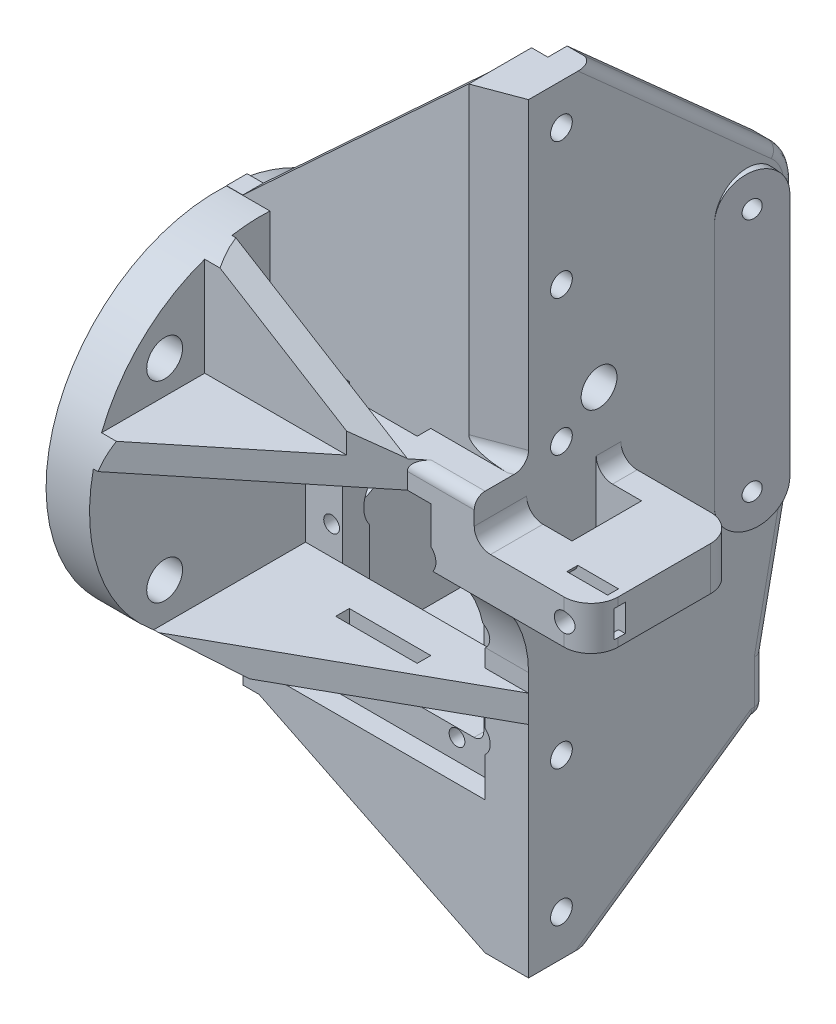
from build123d import *

# Parameters (mm, degrees)
SKETCH1_R                           = 1.45
BOSS_EXTRUDE1_DEPTH                 = 3
BOSS_EXTRUDE2_START                 = -30
SKETCH1_3_R                         = 1.45
BOSS_EXTRUDE2_DEPTH                 = 3
SKETCH2_W                           = 24.17
SKETCH2_H                           = 13.191875796
CUT_EXTRUDE1_DEPTH                  = 67.8688194
SKETCH3_W                           = 5
SKETCH3_H                           = 56.2
BOSS_EXTRUDE3_DEPTH                 = 33
SKETCH4_W                           = 49.6
SKETCH4_H                           = 5
BOSS_EXTRUDE4_DEPTH                 = 36
SKETCH6_R                           = 31.5
BOSS_EXTRUDE6_DEPTH                 = 5
F_6_0MM_CLEARANCE_DOWEL_HOLE1_D     = 3
F_6_0MM_CLEARANCE_DOWEL_HOLE1_DEPTH = 20
F_6_0MM_CLEARANCE_DOWEL_HOLE1_TIP   = 0.901290929
BOSS_EXTRUDE7_DEPTH                 = 5
SKETCH11_W                          = 12.1
SKETCH11_H                          = 140
BOSS_EXTRUDE8_DEPTH                 = 8
SKETCH12_R                          = 1.45
BOSS_EXTRUDE9_DEPTH                 = 2
BOSS_EXTRUDE12_DEPTH                = 5
BOSS_EXTRUDE13_DEPTH                = 5
BOSS_EXTRUDE14_DEPTH                = 5
CUT_EXTRUDE3_DEPTH                  = 41.6
CUT_EXTRUDE4_DEPTH                  = 20
BOSS_EXTRUDE15_START                = -12.1
BOSS_EXTRUDE15_DEPTH                = 12.1
BOSS_EXTRUDE18_DEPTH                = 3
BOSS_EXTRUDE18_DEPTH_BACK           = 0.8
CUT_EXTRUDE6_DEPTH                  = 150.055833525
CUT_EXTRUDE6_DEPTH_BACK             = 70
SKETCH22_W                          = 7
SKETCH22_H                          = 7.75
BOSS_EXTRUDE19_DEPTH                = 58.4
BOSS_EXTRUDE20_DEPTH                = 5
SKETCH25_W                          = 15
SKETCH25_H                          = 2.5
CUT_EXTRUDE7_DEPTH                  = 10
CUT_EXTRUDE8_START                  = -36.2
SKETCH25_3_W                        = 15
SKETCH25_3_H                        = 2.5
CUT_EXTRUDE8_DEPTH                  = 10
BOSS_EXTRUDE22_DEPTH                = 4
SKETCH29_W                          = 2
SKETCH29_H                          = 5
CUT_EXTRUDE9_DEPTH                  = 40
SKETCH30_R                          = 1.75
CUT_EXTRUDE10_DEPTH                 = 40
SKETCH31_R                          = 2
CUT_EXTRUDE11_DEPTH                 = 7
CUT_EXTRUDE12_START                 = -8
CUT_EXTRUDE12_DEPTH                 = 8
FILLET1_R                           = 2
SKETCH33_W                          = 8
SKETCH33_H                          = 2.6
SKETCH33_H_2                        = 5
SKETCH33_W_2                        = 4.320441989
BOSS_EXTRUDE24_DEPTH                = 10
FILLET3_R                           = 20
FILLET5_R                           = 2
FILLET6_R                           = 2.5
SKETCH34_R                          = 3.3
CUT_EXTRUDE13_DEPTH                 = 138.618212821
FILLET7_R                           = 5
FILLET12_R                          = 3
SKETCH35_W                          = 3
SKETCH35_H                          = 3.55
CUT_EXTRUDE14_DEPTH                 = 114.6
BOSS_EXTRUDE26_START                = 3
SKETCH36_R                          = 3.3
BOSS_EXTRUDE26_DEPTH                = 3
CUT_EXTRUDE15_REACH                 = 137.103
SKETCH37_R                          = 5.5
CUT_EXTRUDE15_DIRECTION_2_DEPTH     = 4.5
FILLET14_R                          = 5
CUT_EXTRUDE16_DEPTH                 = 7
LPATTERN1_COUNT                     = 3
LPATTERN1_PITCH                     = 25
LPATTERN2_COUNT                     = 3
LPATTERN2_PITCH                     = 25
REVOLVE1_ANGLE                      = 10
BOSS_EXTRUDE28_DEPTH                = 5
SKETCH40_R                          = 1.6
CUT_EXTRUDE17_DEPTH                 = 127.74510061
CUT_EXTRUDE20_START                 = -4
SKETCH44_R                          = 3.25
CUT_EXTRUDE20_DEPTH                 = 35
CUT_EXTRUDE21_REACH                 = 143.668
SKETCH48_W                          = 39.6
SKETCH48_H                          = 56.2
CUT_EXTRUDE23_DEPTH                 = 1.2
CUT_EXTRUDE24_DEPTH                 = 99.09345212
CUT_EXTRUDE24_DEPTH_BACK            = 99.09345212
SKETCH50_W                          = 39.6
SKETCH50_H                          = 31.2
CUT_EXTRUDE25_DEPTH                 = 1.5
BOSS_EXTRUDE29_START                = 2
SKETCH51_R                          = 1.45
BOSS_EXTRUDE29_DEPTH                = 2
BOSS_EXTRUDE30_START                = -5
BOSS_EXTRUDE30_DEPTH                = 5
FILLET15_R                          = 2
FILLET16_R                          = 2
SKETCH53_R                          = 2.75
CUT_EXTRUDE26_DEPTH                 = 127.854538645


with BuildPart() as part:
    # Sketch1 → Boss-Extrude1 (new body)
    # profile 1 of 2: a face of its own
    with BuildSketch(Plane.XY):
        with BuildLine():
            Line((-11.785, 45), (-11.279987437, 45))
            ThreePointArc((-11.279987437, 45), (-10.804615242, 45.223368794), (-10.285, 45.3))
            Line((-10.285, 45.3), (10.285, 45.3))
            ThreePointArc((10.285, 45.3), (10.804615242, 45.223368794), (11.279987437, 45))
            Line((11.279987437, 45), (11.786572875, 45))
            ThreePointArc((11.786572875, 45), (12.169256308, 44.923879533), (12.493679656, 44.707106781))
            Line((12.493679656, 44.707106781), (17.507893219, 39.692893219))
            ThreePointArc((17.507893219, 39.692893219), (17.72466597, 39.36846987), (17.800786438, 38.985786438))
            Line((17.800786438, 38.985786438), (17.800786438, 0.414213562))
            ThreePointArc((17.800786438, 0.414213562), (17.72466597, 0.03153013), (17.507893219, -0.292893219))
            Line((17.507893219, -0.292893219), (12.493679656, -5.307106781))
            ThreePointArc((12.493679656, -5.307106781), (12.169256308, -5.523879533), (11.786572875, -5.6))
            Line((11.786572875, -5.6), (24.800786438, -5.6))
            Line((24.800786438, -5.6), (24.800786438, 50.6))
            Line((24.800786438, 50.6), (-24.799213562, 50.6))
            Line((-24.799213562, 50.6), (-24.799213562, -5.6))
            Line((-24.799213562, -5.6), (-11.785, -5.6))
            ThreePointArc((-11.785, -5.6), (-12.167683432, -5.523879533), (-12.492106781, -5.307106781))
            Line((-12.492106781, -5.307106781), (-17.506320344, -0.292893219))
            ThreePointArc((-17.506320344, -0.292893219), (-17.723093095, 0.03153013), (-17.799213562, 0.414213562))
            Line((-17.799213562, 0.414213562), (-17.799213562, 38.985786438))
            ThreePointArc((-17.799213562, 38.985786438), (-17.723093095, 39.36846987), (-17.506320344, 39.692893219))
            Line((-17.506320344, 39.692893219), (-12.492106781, 44.707106781))
            ThreePointArc((-12.492106781, 44.707106781), (-12.167683432, 44.923879533), (-11.785, 45))
        make_face()
    # profile 2 of 2: a face of its own
    with BuildSketch(Plane.XY):
        with BuildLine():
            ThreePointArc((-12.085, 43.5), (-11.871029222, 44.351182299), (-11.279987437, 45))
            Line((-11.279987437, 45), (-11.785, 45))
            ThreePointArc((-11.785, 45), (-12.167683432, 44.923879533), (-12.492106781, 44.707106781))
            Line((-12.492106781, 44.707106781), (-17.506320344, 39.692893219))
            ThreePointArc((-17.506320344, 39.692893219), (-17.723093095, 39.36846987), (-17.799213562, 38.985786438))
            Line((-17.799213562, 38.985786438), (-17.799213562, 0.414213562))
            ThreePointArc((-17.799213562, 0.414213562), (-17.723093095, 0.03153013), (-17.506320344, -0.292893219))
            Line((-17.506320344, -0.292893219), (-12.492106781, -5.307106781))
            ThreePointArc((-12.492106781, -5.307106781), (-12.167683432, -5.523879533), (-11.785, -5.6))
            Line((-11.785, -5.6), (11.786572875, -5.6))
            ThreePointArc((11.786572875, -5.6), (12.169256308, -5.523879533), (12.493679656, -5.307106781))
            Line((12.493679656, -5.307106781), (17.507893219, -0.292893219))
            ThreePointArc((17.507893219, -0.292893219), (17.72466597, 0.03153013), (17.800786438, 0.414213562))
            Line((17.800786438, 0.414213562), (17.800786438, 38.985786438))
            ThreePointArc((17.800786438, 38.985786438), (17.72466597, 39.36846987), (17.507893219, 39.692893219))
            Line((17.507893219, 39.692893219), (12.493679656, 44.707106781))
            ThreePointArc((12.493679656, 44.707106781), (12.169256308, 44.923879533), (11.786572875, 45))
            Line((11.786572875, 45), (11.279987437, 45))
            ThreePointArc((11.279987437, 45), (11.871029222, 44.351182299), (12.085, 43.5))
            Line((12.085, 43.5), (12.085, 1.5))
            ThreePointArc((12.085, 1.5), (11.557792206, 0.227207794), (10.285, -0.3))
            Line((10.285, -0.3), (-10.285, -0.3))
            ThreePointArc((-10.285, -0.3), (-11.557792206, 0.227207794), (-12.085, 1.5))
            Line((-12.085, 1.5), (-12.085, 43.5))
        make_face()
        with Locations((-14.999213562, 2.7)):
            Circle(SKETCH1_R, mode=Mode.SUBTRACT)
        with Locations((-7.697477522, -2.8)):
            Circle(SKETCH1_R, mode=Mode.SUBTRACT)
        with Locations((-14.999213562, 19.7)):
            Circle(SKETCH1_R, mode=Mode.SUBTRACT)
        with Locations((8.076300654, -2.8)):
            Circle(SKETCH1_R, mode=Mode.SUBTRACT)
        with Locations((15.000786438, 2.7)):
            Circle(SKETCH1_R, mode=Mode.SUBTRACT)
        with Locations((15.000786438, 19.7)):
            Circle(SKETCH1_R, mode=Mode.SUBTRACT)
        with Locations((-14.999213562, 36.7)):
            Circle(SKETCH1_R, mode=Mode.SUBTRACT)
        with Locations((15.000786438, 36.7)):
            Circle(SKETCH1_R, mode=Mode.SUBTRACT)
    extrude(amount=BOSS_EXTRUDE1_DEPTH)


with BuildPart() as body_2:
    # Sketch1<3> → Boss-Extrude2 (new body)
    # profile 1 of 2: a face of its own
    with BuildSketch(Plane.XY.offset(BOSS_EXTRUDE2_START)):
        with BuildLine():
            Line((-11.785, 45), (-11.279987437, 45))
            ThreePointArc((-11.279987437, 45), (-10.804615242, 45.223368794), (-10.285, 45.3))
            Line((-10.285, 45.3), (10.285, 45.3))
            ThreePointArc((10.285, 45.3), (10.804615242, 45.223368794), (11.279987437, 45))
            Line((11.279987437, 45), (11.786572875, 45))
            ThreePointArc((11.786572875, 45), (12.169256308, 44.923879533), (12.493679656, 44.707106781))
            Line((12.493679656, 44.707106781), (17.507893219, 39.692893219))
            ThreePointArc((17.507893219, 39.692893219), (17.72466597, 39.36846987), (17.800786438, 38.985786438))
            Line((17.800786438, 38.985786438), (17.800786438, 0.414213562))
            ThreePointArc((17.800786438, 0.414213562), (17.72466597, 0.03153013), (17.507893219, -0.292893219))
            Line((17.507893219, -0.292893219), (12.493679656, -5.307106781))
            ThreePointArc((12.493679656, -5.307106781), (12.169256308, -5.523879533), (11.786572875, -5.6))
            Line((11.786572875, -5.6), (24.800786438, -5.6))
            Line((24.800786438, -5.6), (24.800786438, 50.6))
            Line((24.800786438, 50.6), (-24.799213562, 50.6))
            Line((-24.799213562, 50.6), (-24.799213562, -5.6))
            Line((-24.799213562, -5.6), (-11.785, -5.6))
            ThreePointArc((-11.785, -5.6), (-12.167683432, -5.523879533), (-12.492106781, -5.307106781))
            Line((-12.492106781, -5.307106781), (-17.506320344, -0.292893219))
            ThreePointArc((-17.506320344, -0.292893219), (-17.723093095, 0.03153013), (-17.799213562, 0.414213562))
            Line((-17.799213562, 0.414213562), (-17.799213562, 38.985786438))
            ThreePointArc((-17.799213562, 38.985786438), (-17.723093095, 39.36846987), (-17.506320344, 39.692893219))
            Line((-17.506320344, 39.692893219), (-12.492106781, 44.707106781))
            ThreePointArc((-12.492106781, 44.707106781), (-12.167683432, 44.923879533), (-11.785, 45))
        make_face()
    # profile 2 of 2: a face of its own
    with BuildSketch(Plane.XY.offset(BOSS_EXTRUDE2_START)):
        with BuildLine():
            ThreePointArc((-12.085, 43.5), (-11.871029222, 44.351182299), (-11.279987437, 45))
            Line((-11.279987437, 45), (-11.785, 45))
            ThreePointArc((-11.785, 45), (-12.167683432, 44.923879533), (-12.492106781, 44.707106781))
            Line((-12.492106781, 44.707106781), (-17.506320344, 39.692893219))
            ThreePointArc((-17.506320344, 39.692893219), (-17.723093095, 39.36846987), (-17.799213562, 38.985786438))
            Line((-17.799213562, 38.985786438), (-17.799213562, 0.414213562))
            ThreePointArc((-17.799213562, 0.414213562), (-17.723093095, 0.03153013), (-17.506320344, -0.292893219))
            Line((-17.506320344, -0.292893219), (-12.492106781, -5.307106781))
            ThreePointArc((-12.492106781, -5.307106781), (-12.167683432, -5.523879533), (-11.785, -5.6))
            Line((-11.785, -5.6), (11.786572875, -5.6))
            ThreePointArc((11.786572875, -5.6), (12.169256308, -5.523879533), (12.493679656, -5.307106781))
            Line((12.493679656, -5.307106781), (17.507893219, -0.292893219))
            ThreePointArc((17.507893219, -0.292893219), (17.72466597, 0.03153013), (17.800786438, 0.414213562))
            Line((17.800786438, 0.414213562), (17.800786438, 38.985786438))
            ThreePointArc((17.800786438, 38.985786438), (17.72466597, 39.36846987), (17.507893219, 39.692893219))
            Line((17.507893219, 39.692893219), (12.493679656, 44.707106781))
            ThreePointArc((12.493679656, 44.707106781), (12.169256308, 44.923879533), (11.786572875, 45))
            Line((11.786572875, 45), (11.279987437, 45))
            ThreePointArc((11.279987437, 45), (11.871029222, 44.351182299), (12.085, 43.5))
            Line((12.085, 43.5), (12.085, 1.5))
            ThreePointArc((12.085, 1.5), (11.557792206, 0.227207794), (10.285, -0.3))
            Line((10.285, -0.3), (-10.285, -0.3))
            ThreePointArc((-10.285, -0.3), (-11.557792206, 0.227207794), (-12.085, 1.5))
            Line((-12.085, 1.5), (-12.085, 43.5))
        make_face()
        with Locations((-14.999213562, 2.7)):
            Circle(SKETCH1_3_R, mode=Mode.SUBTRACT)
        with Locations((-7.697477522, -2.8)):
            Circle(SKETCH1_3_R, mode=Mode.SUBTRACT)
        with Locations((-14.999213562, 19.7)):
            Circle(SKETCH1_3_R, mode=Mode.SUBTRACT)
        with Locations((8.076300654, -2.8)):
            Circle(SKETCH1_3_R, mode=Mode.SUBTRACT)
        with Locations((15.000786438, 2.7)):
            Circle(SKETCH1_3_R, mode=Mode.SUBTRACT)
        with Locations((15.000786438, 19.7)):
            Circle(SKETCH1_3_R, mode=Mode.SUBTRACT)
        with Locations((-14.999213562, 36.7)):
            Circle(SKETCH1_3_R, mode=Mode.SUBTRACT)
        with Locations((15.000786438, 36.7)):
            Circle(SKETCH1_3_R, mode=Mode.SUBTRACT)
    extrude(amount=-BOSS_EXTRUDE2_DEPTH)


with BuildPart() as cut_extrude1_tool:
    # Sketch2 → Cut-Extrude1 (new, through all)
    with BuildSketch(Plane.XY.offset(3)):
        with Locations((0, 50.095937898)):
            Rectangle(SKETCH2_W, SKETCH2_H)
    extrude(amount=-CUT_EXTRUDE1_DEPTH)


with BuildPart() as part_1:
    add(part.part)

    # Cut-Extrude1: cut by cut_extrude1_tool
    add(cut_extrude1_tool.part, mode=Mode.SUBTRACT)



with BuildPart() as body_2_1:
    add(body_2.part)

    # Cut-Extrude1: cut by cut_extrude1_tool
    add(cut_extrude1_tool.part, mode=Mode.SUBTRACT)


with BuildPart() as part_2:
    add(part_1.part)

    add(body_2_1.part)  # Boss-Extrude3 merges body 2
    # Sketch3 → Boss-Extrude3 (add)
    with BuildSketch(Plane(origin=(0, 0, -33), x_dir=(-1, 0, 0), z_dir=(0, 0, -1))):
        with Locations((-22.300786438, 22.5)):
            Rectangle(SKETCH3_W, SKETCH3_H)
        with Locations((22.299213562, 22.5)):
            Rectangle(SKETCH3_W, SKETCH3_H)
    extrude(amount=-BOSS_EXTRUDE3_DEPTH)

    # Sketch4 → Boss-Extrude4 (add)
    with BuildSketch(Plane(origin=(0, 0, -33), x_dir=(-1, 0, 0), z_dir=(0, 0, -1))):
        with Locations((-0.000786438, -8.1)):
            Rectangle(SKETCH4_W, SKETCH4_H)
    extrude(amount=-BOSS_EXTRUDE4_DEPTH)

    # Sketch6 → Boss-Extrude6 (add)
    with BuildSketch(Plane.ZY.offset(24.799213562)):
        with Locations((13.25, 39)):
            Circle(SKETCH6_R)
    extrude(amount=-BOSS_EXTRUDE6_DEPTH)

    # Ø6.0mm Clearance Dowel Hole1
    with Locations(Plane.ZY.offset(24.799213562)):
        with Locations((30.92766953, 21.32233047), (-4.42766953, 21.32233047), (-4.42766953, 56.67766953), (30.92766953, 56.67766953)):
            Hole(F_6_0MM_CLEARANCE_DOWEL_HOLE1_D / 2, depth=F_6_0MM_CLEARANCE_DOWEL_HOLE1_DEPTH)
            with Locations((0, 0, -(F_6_0MM_CLEARANCE_DOWEL_HOLE1_DEPTH + F_6_0MM_CLEARANCE_DOWEL_HOLE1_TIP / 2))):  # 118° drill point
                Cone(0, F_6_0MM_CLEARANCE_DOWEL_HOLE1_D / 2, F_6_0MM_CLEARANCE_DOWEL_HOLE1_TIP, mode=Mode.SUBTRACT)

    # Sketch9 → Boss-Extrude7 (add)
    with BuildSketch(Plane.ZY.offset(24.799213562)):
        with BuildLine():
            Line((3, 9.214307126), (3, -10.6))
            Line((3, -10.6), (33.441364403, 14.82234909))
            ThreePointArc((33.441364403, 14.82234909), (18.957032085, 8.021301112), (3, 9.214307126))
        make_face()
        with BuildLine():
            ThreePointArc((-16.036344941, 50.6), (-10.096273097, 60.147140055), (-1.181422858, 66.999714896))
            Line((-1.181422858, 66.999714896), (-33, 50.6))
            Line((-33, 50.6), (-16.036344941, 50.6))
        make_face()
    extrude(amount=-BOSS_EXTRUDE7_DEPTH)

    # Sketch11 → Boss-Extrude8 (add)
    with BuildSketch(Plane(origin=(24.800786438, 0, 0), x_dir=(0, 0, -1), z_dir=(1, 0, 0))):
        with Locations((-2.5, 39)):
            Rectangle(SKETCH11_W, SKETCH11_H)
    extrude(amount=-BOSS_EXTRUDE8_DEPTH)

    # Sketch12 → Boss-Extrude9 (add)
    with BuildSketch(Plane.XY.offset(3)):
        with BuildLine():
            Line((-19.799213562, -10.6), (16.800786438, -10.6))
            Line((16.800786438, -10.6), (16.800786438, 50.6))
            Line((16.800786438, 50.6), (12.085, 50.6))
            Line((12.085, 50.6), (12.085, 1.5))
            ThreePointArc((12.085, 1.5), (11.557792206, 0.227207794), (10.285, -0.3))
            Line((10.285, -0.3), (-10.285, -0.3))
            ThreePointArc((-10.285, -0.3), (-11.557792206, 0.227207794), (-12.085, 1.5))
            Line((-12.085, 1.5), (-12.085, 50.6))
            Line((-12.085, 50.6), (-19.799213562, 50.6))
            Line((-19.799213562, 50.6), (-19.799213562, -10.6))
        make_face()
        with Locations((-14.999213562, 36.7)):
            Circle(SKETCH12_R, mode=Mode.SUBTRACT)
        with Locations((15.000786438, 36.7)):
            Circle(SKETCH12_R, mode=Mode.SUBTRACT)
        with Locations((15.000786438, 19.7)):
            Circle(SKETCH12_R, mode=Mode.SUBTRACT)
        with Locations((15.000786438, 2.7)):
            Circle(SKETCH12_R, mode=Mode.SUBTRACT)
        with Locations((8.076300654, -2.8)):
            Circle(SKETCH12_R, mode=Mode.SUBTRACT)
        with Locations((-7.697477522, -2.8)):
            Circle(SKETCH12_R, mode=Mode.SUBTRACT)
        with Locations((-14.999213562, 2.7)):
            Circle(SKETCH12_R, mode=Mode.SUBTRACT)
        with Locations((-14.999213562, 19.7)):
            Circle(SKETCH12_R, mode=Mode.SUBTRACT)
    extrude(amount=BOSS_EXTRUDE9_DEPTH)

    # Sketch15 → Boss-Extrude12 (add)
    with BuildSketch(Plane(origin=(0, 50.6, 0), x_dir=(1, 0, 0), z_dir=(0, 1, 0))):
        Polygon((-19.799213562, -5), (-19.799213562, -44.75), (24.800786438, -8.55), (24.800786438, -5), (16.800786438, -5), (12.085, -5), align=None)
    extrude(amount=-BOSS_EXTRUDE12_DEPTH)

    # Sketch16 → Boss-Extrude13 (add)
    with BuildSketch(Plane(origin=(0, 14.4, 0), x_dir=(-1, 0, 0), z_dir=(0, -1, 0))):
        Polygon((19.799213562, -33.441364403), (19.799213562, -5), (-16.800786438, -5), (-24.800786438, -5), (-24.800786438, -8.55), align=None)
    extrude(amount=BOSS_EXTRUDE13_DEPTH)

    # Sketch17 → Boss-Extrude14 (add)
    with BuildSketch(Plane.XY.offset(18.55)):
        Polygon((-19.799213562, 50.6), (-19.799213562, 70.5), (12.554276621, 50.6), align=None)
    extrude(amount=BOSS_EXTRUDE14_DEPTH)

    # Sketch18 → Cut-Extrude3 (cut)
    with BuildSketch(Plane.ZY.offset(24.799213562)):
        with BuildLine():
            Line((33.441364403, 14.82234909), (3, -10.6))
            Line((3, -10.6), (3, -33.726099951))
            Line((3, -33.726099951), (83.736022906, -32.289383721))
            Line((83.736022906, -32.289383721), (81.775858057, 77.86174484))
            Line((81.775858057, 77.86174484), (3, 77.86174484))
            Line((3, 77.86174484), (3, 68.785692874))
            ThreePointArc((3, 68.785692874), (40.685712122, 54.476811699), (33.441364403, 14.82234909))
        make_face()
    extrude(amount=-CUT_EXTRUDE3_DEPTH, mode=Mode.SUBTRACT)

    # Sketch19 → Cut-Extrude4 (cut)
    with BuildSketch(Plane.XZ.offset(-45.6)):
        Polygon((42.107625717, 23.818903774), (24.800786438, 8.55), (-18.937782646, 44.050811678), (-12.085, 55.699572505), align=None)
    extrude(amount=-CUT_EXTRUDE4_DEPTH, mode=Mode.SUBTRACT)

    # Boss-Extrude15: read off the stored shape, not the designer's step
    # Boss-Extrude15 outline → Boss-Extrude15 (add)
    with BuildSketch(Plane.XY.offset(8.55).offset(BOSS_EXTRUDE15_START)):
        Polygon((-24.799213562, 9.4), (-24.799213562, -10.6), (16.800786438, -31), (16.800786438, -6.6), (-19.799213562, -6.6), (-19.799213562, 9.4), align=None)
    extrude(amount=BOSS_EXTRUDE15_DEPTH)

    # Sketch21 → Boss-Extrude18 (add, two sides: drawn at the far end of the back side and taken through both)
    with BuildSketch(Plane.XY.offset(8.55).offset(-BOSS_EXTRUDE18_DEPTH_BACK)):
        Polygon((16.800786438, 109), (-24.799213562, 70.5), (-24.799213562, 50.6), (16.800786438, 50.6), align=None)
    extrude(amount=BOSS_EXTRUDE18_DEPTH + BOSS_EXTRUDE18_DEPTH_BACK)

    # Sketch22 → Cut-Extrude6 (cut, two sides: drawn at the far end of the back side and taken through both)
    with BuildSketch(Plane(origin=(0, 109, 0), x_dir=(1, 0, 0), z_dir=(0, 1, 0)).offset(-CUT_EXTRUDE6_DEPTH_BACK)):
        with Locations((0, -3.875)):
            Rectangle(SKETCH22_W, SKETCH22_H)
    extrude(amount=CUT_EXTRUDE6_DEPTH + CUT_EXTRUDE6_DEPTH_BACK, mode=Mode.SUBTRACT)

    # Sketch23 → Boss-Extrude19 (add)
    with BuildSketch(Plane(origin=(0, 109, 0), x_dir=(1, 0, 0), z_dir=(0, 1, 0))):
        Polygon((16.800786438, -11.55), (16.800786438, -8.55), (24.800786438, -8.55), align=None)
    extrude(amount=-BOSS_EXTRUDE19_DEPTH)

    # Sketch24 → Boss-Extrude20 (add)
    with BuildSketch(Plane(origin=(24.800786438, 0, 0), x_dir=(0, 0, -1), z_dir=(1, 0, 0))):
        Polygon((33, -10.6), (3.55, -31), (3.55, -10.6), align=None)
        Polygon((33, 50.6), (3.55, 109), (3.55, 50.6), align=None)
    extrude(amount=-BOSS_EXTRUDE20_DEPTH)

    # Sketch25 → Cut-Extrude7 (cut)
    with BuildSketch(Plane(origin=(0, 50.6, 0), x_dir=(1, 0, 0), z_dir=(0, 1, 0))):
        with Locations((2.300786438, -12.8)):
            Rectangle(SKETCH25_W, SKETCH25_H)
    extrude(amount=-CUT_EXTRUDE7_DEPTH, mode=Mode.SUBTRACT)

    # Sketch25<3> → Cut-Extrude8 (cut)
    with BuildSketch(Plane(origin=(0, 50.6, 0), x_dir=(1, 0, 0), z_dir=(0, 1, 0)).offset(CUT_EXTRUDE8_START)):
        with Locations((2.300786438, -12.8)):
            Rectangle(SKETCH25_3_W, SKETCH25_3_H)
    extrude(amount=-CUT_EXTRUDE8_DEPTH, mode=Mode.SUBTRACT)

    # Sketch28 → Boss-Extrude22 (add, symmetric)
    with BuildSketch(Plane(origin=(0, 39, 0), x_dir=(-1, 0, 0), z_dir=(0, -1, 0))):
        Polygon((-24.800786438, 8.434283838), (-24.800786438, 3.65), (-32.900786438, 3.65), (-32.900786438, -8.65), (-24.800786438, -8.65), (-24.800786438, -8.55), (-16.800786438, -8.55), (-16.800786438, -18.55), (-46.300786438, -18.55), (-46.300786438, 8.434283838), align=None)
    extrude(amount=BOSS_EXTRUDE22_DEPTH, both=True)

    # Sketch29 → Cut-Extrude9 (cut)
    with BuildSketch(Plane(origin=(46.300786438, 0, 0), x_dir=(0, 0, -1), z_dir=(1, 0, 0))):
        with Locations((-13.25, 39)):
            Rectangle(SKETCH29_W, SKETCH29_H)
    extrude(amount=-CUT_EXTRUDE9_DEPTH, mode=Mode.SUBTRACT)

    # Sketch30 → Cut-Extrude10 (cut)
    with BuildSketch(Plane.XY.offset(18.55)):
        with Locations(Location((41.300786438, 39, 0), (0, 0, 180))):
            Circle(SKETCH30_R)
    extrude(amount=-CUT_EXTRUDE10_DEPTH, mode=Mode.SUBTRACT)

    # Sketch31 → Cut-Extrude11 (cut)
    with BuildSketch(Plane(origin=(0, 0, -8.434283838), x_dir=(-1, 0, 0), z_dir=(0, 0, -1))):
        with Locations((-41.300786438, 39)):
            Circle(SKETCH31_R)
    extrude(amount=-CUT_EXTRUDE11_DEPTH, mode=Mode.SUBTRACT)

    # Sketch32 → Cut-Extrude12 (cut)
    with BuildSketch(Plane.XZ.offset(-35).offset(CUT_EXTRUDE12_START)):
        Polygon((37.550786438, 14.25), (37.550786438, 12.25), (39.550786438, 12.25), (43.050786438, 12.25), (45.050786438, 12.25), (45.050786438, 14.25), align=None)
    extrude(amount=CUT_EXTRUDE12_DEPTH, mode=Mode.SUBTRACT)

    # Fillet1
    # the kernel refuses this fillet: 2 mm, written as the material it takes off along each edge
    with BuildSketch(Plane(origin=(37.550786438, 41.5, 12.25), x_dir=(-1, 0, 0), z_dir=(0, 0, 1)), Plane(origin=(37.550786438, 36.5, 14.25), x_dir=(-1, 0, 0), z_dir=(0, 0, -1))) as fillet1_piece_1:
        with BuildLine():
            CenterArc((1.936491673, -2), FILLET1_R, 90, 75.522487814)
            Line((0, -1.5), (-0.038729833, -1.49))
            ThreePointArc((-0.038729833, -1.49), (-0.04, -0.75), (-0.04, 0))
            Line((-0.04, 0), (0, 0.04))
            Line((0, 0.04), (1.936491673, 0.04))
            Line((1.936491673, 0.04), (1.936491673, 0))
        make_face()
    extrude(amount=2, mode=Mode.SUBTRACT)

    # Sketch33 → Boss-Extrude24 (add)
    with BuildSketch(Plane.XY.offset(18.55)):
        with Locations((20.800786438, 44.3)):
            Rectangle(SKETCH33_W, SKETCH33_H)
        with Locations((20.800786438, 48.1)):
            Rectangle(SKETCH33_W, SKETCH33_H_2)
        with Locations((14.640565443, 48.1)):
            Rectangle(SKETCH33_W_2, SKETCH33_H_2)
    extrude(amount=-BOSS_EXTRUDE24_DEPTH)

    # Fillet3
    # the kernel refuses this fillet: 20 mm, written as the material it adds along each edge
    with BuildSketch(Plane(origin=(24.800786438, 35, 8.55), x_dir=(0, -1, 0), z_dir=(-1, 0, 0))) as fillet3_piece_1:
        with BuildLine():
            CenterArc((17.320508076, 20), FILLET3_R, 210, 60)
            Line((0, 10), (-0.346410162, 9.8))
            ThreePointArc((-0.346410162, 9.8), (-0.4, 5), (-0.4, 0))
            Line((-0.4, 0), (0, -0.4))
            Line((0, -0.4), (17.320508076, -0.4))
            Line((17.320508076, -0.4), (17.320508076, 0))
        make_face()
    extrude(amount=8)

    # Fillet5
    fillet5_edges = [part_2.edges().sort_by_distance(p)[0] for p in [
        (18.640565443, 50.6, 18.55),
    ]]
    fillet(fillet5_edges, radius=FILLET5_R)

    # Fillet6
    fillet6_edges = [part_2.edges().sort_by_distance(p)[0] for p in [
        (20.800786438, 50.6, 10.05),
    ]]
    fillet(fillet6_edges, radius=FILLET6_R)

    # Sketch34 → Cut-Extrude13 (cut, through all)
    with BuildSketch(Plane.ZY.offset(24.799213562)):
        with Locations(Location((30.92766953, 21.32233047, 0), (0, 0, 270))):
            Circle(SKETCH34_R)
        with Locations(Location((30.92766953, 56.67766953, 0), (0, 0, 270))):
            Circle(SKETCH34_R)
        with Locations(Location((-4.42766953, 56.67766953, 0), (0, 0, 285.424031502))):
            Circle(SKETCH34_R)
        with Locations(Location((-4.42766953, 21.32233047, 0), (0, 0, 285.424031502))):
            Circle(SKETCH34_R)
    extrude(amount=-CUT_EXTRUDE13_DEPTH, mode=Mode.SUBTRACT)

    # Fillet7
    # the kernel refuses this fillet: 5 mm, written as the material it takes off along each edge
    with BuildSketch(Plane(origin=(46.300786438, 55.5, -8.434283838), x_dir=(-1, 0, 0), z_dir=(0, -1, 0))) as fillet7_piece_1:
        with BuildLine():
            CenterArc((FILLET7_R, -FILLET7_R), FILLET7_R, 90, 90)
            Line((0, -FILLET7_R), (0, 0))
            Line((0, 0), (FILLET7_R, 0))
        make_face()
    extrude(amount=33, mode=Mode.SUBTRACT)
    with BuildSketch(Plane(origin=(46.300786438, 55.5, 18.55), x_dir=(-1, 0, 0), z_dir=(0, -1, 0))) as fillet7_piece_2:
        with BuildLine():
            CenterArc((FILLET7_R, FILLET7_R), FILLET7_R, 180, 90)
            Line((0, FILLET7_R), (0, 0))
            Line((0, 0), (FILLET7_R, 0))
        make_face()
    extrude(amount=33, mode=Mode.SUBTRACT)

    # Fillet12
    # the kernel refuses this fillet: 3 mm, written as the material it adds along each edge
    with BuildSketch(Plane(origin=(24.800786438, 35, -8.434283838), x_dir=(0, -1, 0), z_dir=(0, 0, 1))) as fillet12_piece_1:
        with BuildLine():
            CenterArc((FILLET12_R, FILLET12_R), FILLET12_R, 180, 90)
            Line((0, FILLET12_R), (0, 0))
            Line((0, 0), (FILLET12_R, 0))
        make_face()
    extrude(amount=4.784283838)
    with BuildSketch(Plane(origin=(24.800786438, 43, -8.434283838), x_dir=(0, 1, 0), z_dir=(0, 0, 1))) as fillet12_piece_2:
        with BuildLine():
            CenterArc((FILLET12_R, -FILLET12_R), FILLET12_R, 90, 90)
            Line((0, -FILLET12_R), (0, 0))
            Line((0, 0), (FILLET12_R, 0))
        make_face()
    extrude(amount=4.784283838)
    with BuildSketch(Plane(origin=(24.800786438, 43, 18.55), x_dir=(0, 1, 0), z_dir=(0, 0, -1))) as fillet12_piece_3:
        with BuildLine():
            CenterArc((FILLET12_R, FILLET12_R), FILLET12_R, 180, 90)
            Line((0, FILLET12_R), (0, 0))
            Line((0, 0), (FILLET12_R, 0))
        make_face()
    extrude(amount=9.9)
    with BuildSketch(Plane(origin=(24.800786438, 35, 18.55), x_dir=(0, -1, 0), z_dir=(0, 0, -1))) as fillet12_piece_4_section:
        with BuildLine():
            CenterArc((FILLET12_R, -FILLET12_R), FILLET12_R, 90, 90)
            Line((0, -FILLET12_R), (0, 0))
            Line((0, 0), (FILLET12_R, 0))
        make_face()
    fillet12_piece_4 = extrude(amount=9.9, mode=Mode.PRIVATE)
    fillet12_piece_4 = fillet12_piece_4 - Plane(origin=(24.800786438, 17.679491924, 28.55), x_dir=(0, -1, 0), z_dir=(1, 0, 0)) * Cylinder(20, 32, mode=Mode.PRIVATE)
    add(fillet12_piece_4)

    # Sketch35 → Cut-Extrude14 (cut)
    with BuildSketch(Plane(origin=(0, -5.6, 0), x_dir=(1, 0, 0), z_dir=(0, 1, 0))):
        with Locations((18.300786438, 1.775)):
            Rectangle(SKETCH35_W, SKETCH35_H)
    extrude(amount=CUT_EXTRUDE14_DEPTH, mode=Mode.SUBTRACT)

    # Sketch36 → Boss-Extrude26 (add)
    with BuildSketch(Plane.ZY.offset(24.799213562).offset(BOSS_EXTRUDE26_START)):
        with BuildLine():
            Line((11.55, 70.454093533), (11.55, 70.5))
            Line((11.55, 70.5), (7.75, 70.5))
            Line((7.75, 70.5), (7.75, 70.016124839))
            ThreePointArc((7.75, 70.016124839), (3.170809233, 68.843925906), (-1.181422858, 66.999714896))
            Line((-1.181422858, 66.999714896), (-33, 50.6))
            Line((-33, 50.6), (-33, -10.6))
            Line((-33, -10.6), (-3.55, -10.6))
            Line((-3.55, -10.6), (8.55, -10.6))
            Line((8.55, -10.6), (8.55, -5.965055404))
            Line((8.55, -5.965055404), (33.441364403, 14.82234909))
            ThreePointArc((33.441364403, 14.82234909), (42.562205424, 50.534496659), (11.55, 70.454093533))
        make_face()
        with Locations(Location((-4.42766953, 56.67766953, 0), (0, 0, 90))):
            Circle(SKETCH36_R, mode=Mode.SUBTRACT)
        with Locations(Location((-4.42766953, 21.32233047, 0), (0, 0, 90))):
            Circle(SKETCH36_R, mode=Mode.SUBTRACT)
        with Locations(Location((30.92766953, 21.32233047, 0), (0, 0, 270))):
            Circle(SKETCH36_R, mode=Mode.SUBTRACT)
        with Locations(Location((30.92766953, 56.67766953, 0), (0, 0, 270))):
            Circle(SKETCH36_R, mode=Mode.SUBTRACT)
    extrude(amount=-BOSS_EXTRUDE26_DEPTH)

    # Cut-Extrude15: up to this face of the body (flat: up to its plane)
    cut_extrude15_end = Plane(part_2.part.faces().sort_by_distance((-12.085, 26.05, 2.5))[0])
    # Sketch37 → Cut-Extrude15 (cut, up to the picked face)
    with BuildSketch(Plane(origin=(-19.799213562, 0, 0), x_dir=(0, 0, -1), z_dir=(1, 0, 0)), mode=Mode.PRIVATE) as cut_extrude15_sk1:
        with Locations(Location((4.42766953, 21.32233047, 0), (0, 0, 90))):
            Circle(SKETCH37_R)
    cut_extrude15_tool1 = split(extrude(cut_extrude15_sk1.sketch, amount=CUT_EXTRUDE15_REACH, mode=Mode.PRIVATE), bisect_by=cut_extrude15_end, keep=Keep.BOTH, mode=Mode.PRIVATE)
    add(cut_extrude15_tool1.solids().sort_by(Axis((-19.799214, 21.32233, -4.42767), (1, 0, 0)))[0], mode=Mode.SUBTRACT)

    # Sketch37 → Cut-Extrude15 direction 2 (cut)
    with BuildSketch(Plane(origin=(-19.799213562, 0, 0), x_dir=(0, 0, -1), z_dir=(1, 0, 0))):
        with Locations(Location((4.42766953, 21.32233047, 0), (0, 0, 90))):
            Circle(SKETCH37_R)
    extrude(amount=-CUT_EXTRUDE15_DIRECTION_2_DEPTH, mode=Mode.SUBTRACT)

    # Fillet14
    fillet14_edges = [part_2.edges().sort_by_distance(p)[0] for p in [
        (-2.499213562, -10.6, -3.55),
    ]]
    fillet(fillet14_edges, radius=FILLET14_R)

    # Sketch38 → Cut-Extrude16 (cut)
    with BuildSketch(Plane(origin=(24.800786438, 0, 0), x_dir=(0, 0, -1), z_dir=(1, 0, 0))):
        with BuildLine():
            ThreePointArc((-2.5, 53.5), (-4.5, 51.5), (-2.5, 49.5))
            Line((-2.5, 49.5), (-2.5, 53.5))
        make_face()
        with BuildLine():
            Line((-2.5, 53.5), (-2.5, 49.5))
            ThreePointArc((-2.5, 49.5), (-1.085786438, 50.085786438), (-0.5, 51.5))
            ThreePointArc((-0.5, 51.5), (-1.085786438, 52.914213562), (-2.5, 53.5))
        make_face()
        with BuildLine():
            ThreePointArc((-2.5, 28.5), (-4.5, 26.5), (-2.5, 24.5))
            Line((-2.5, 24.5), (-2.5, 28.5))
        make_face()
        with BuildLine():
            Line((-2.5, 28.5), (-2.5, 24.5))
            ThreePointArc((-2.5, 24.5), (-1.085786438, 25.085786438), (-0.5, 26.5))
            ThreePointArc((-0.5, 26.5), (-1.085786438, 27.914213562), (-2.5, 28.5))
        make_face()
    cut_extrude16 = extrude(amount=-CUT_EXTRUDE16_DEPTH, mode=Mode.SUBTRACT)

    # LPattern1: Cut-Extrude16 ×3
    with Locations(*[(0, i * LPATTERN1_PITCH, 0) for i in range(1, LPATTERN1_COUNT)]):
        add(cut_extrude16, mode=Mode.SUBTRACT)

    # LPattern2: Cut-Extrude16 ×3
    with Locations(*[(0, -i * LPATTERN2_PITCH, 0) for i in range(1, LPATTERN2_COUNT)]):
        add(cut_extrude16, mode=Mode.SUBTRACT)

    # Sketch39 → Revolve1 (revolve)
    with BuildSketch(Plane(origin=(24.800786438, 0, 0), x_dir=(0, 0, -1), z_dir=(1, 0, 0))):
        with BuildLine():
            Line((37.65, 72), (37.65, 27))
            ThreePointArc((37.65, 27), (31.65, 21), (25.65, 27))
            Line((25.65, 27), (25.65, 72))
            ThreePointArc((25.65, 72), (31.65, 78), (37.65, 72))
        make_face()
    revolve(axis=Axis((24.800786438, 72, -25.65), (0, -1, 0)), revolution_arc=REVOLVE1_ANGLE)

    # Sketch42 → Boss-Extrude28 (add)
    with BuildSketch(Plane(origin=(24.800786438, 0, 0), x_dir=(0, 0, -1), z_dir=(1, 0, 0))):
        with BuildLine():
            Line((22.65, 71.124278438), (22.65, 72))
            add(Edge.make_bspline(
                [(37.456563624, 78.74555755), (37.237920707, 78.940650146), (36.474834132, 79.557130385), (34.589482554, 80.624304117), (31.558846518, 81.236903674), (28.042836089, 80.526192652), (25.076886953, 78.510089783), (23.108613279, 75.519421514), (22.65, 73.164812838), (22.65, 72)],
                knots=[-0.720940243, -0.720940243, -0.720940243, -0.720940243, -0.622765473, -0.392699082, 0, 0.392699082, 0.785398163, 1.178097245, 1.570796327, 1.570796327, 1.570796327, 1.570796327], degree=3))
            Line((37.456563624, 78.74555755), (3.55, 109))
            Line((3.55, 109), (22.65, 71.124278438))
        make_face()
        with BuildLine():
            Line((25.65, 72), (25.65, 65.175212224))
            Line((25.65, 65.175212224), (25.65, 27))
            ThreePointArc((25.65, 27), (27.391153115, 22.773627654), (31.604074403, 21.000175766))
            add(Edge.make_bspline(
                [(31.604074403, 21.000175766), (37.467693036, 21.045751172), (37.467693036, 27)],
                knots=[3.150081074, 3.150081074, 3.150081074, 4.71238898, 4.71238898, 4.71238898], degree=2, weights=[0.996851577, 0.708689546, 1]))
            Line((37.467693036, 27), (37.467693036, 72))
            add(Edge.make_bspline(
                [(37.467693036, 72), (37.467693036, 78), (31.558846518, 78), (25.65, 78), (25.65, 72)],
                knots=[4.71238898, 4.71238898, 4.71238898, 6.283185307, 6.283185307, 7.853981634, 7.853981634, 7.853981634], degree=2, weights=[1, 0.707106781, 1, 0.707106781, 1]))
        make_face()
        with BuildLine():
            add(Edge.make_bspline(
                [(37.456563624, 78.74555755), (37.237920707, 78.940650146), (36.474834132, 79.557130385), (34.589482554, 80.624304117), (31.558846518, 81.236903674), (28.042836089, 80.526192652), (25.076886953, 78.510089783), (23.108613279, 75.519421514), (22.65, 73.164812838), (22.65, 72)],
                knots=[-0.720940243, -0.720940243, -0.720940243, -0.720940243, -0.622765473, -0.392699082, 0, 0.392699082, 0.785398163, 1.178097245, 1.570796327, 1.570796327, 1.570796327, 1.570796327], degree=3))
            Line((22.65, 72), (22.65, 71.124278438))
            Line((22.65, 71.124278438), (25.65, 65.175212224))
            Line((25.65, 65.175212224), (25.65, 72))
            add(Edge.make_bspline(
                [(37.467693036, 72), (37.467693036, 78), (31.558846518, 78), (25.65, 78), (25.65, 72)],
                knots=[4.71238898, 4.71238898, 4.71238898, 6.283185307, 6.283185307, 7.853981634, 7.853981634, 7.853981634], degree=2, weights=[1, 0.707106781, 1, 0.707106781, 1]))
            Line((37.467693036, 72), (37.467693036, 27))
            add(Edge.make_bspline(
                [(31.604074403, 21.000175766), (37.467693036, 21.045751172), (37.467693036, 27)],
                knots=[3.150081074, 3.150081074, 3.150081074, 4.71238898, 4.71238898, 4.71238898], degree=2, weights=[0.996851577, 0.708689546, 1]))
            ThreePointArc((31.604074403, 21.000175766), (32.306548746, 21.036029532), (33, 21.153847419))
            Line((33, 21.153847419), (33, 18.119115395))
            add(Edge.make_bspline(
                [(33, 18.119115395), (33.680344839, 18.231944892), (35.481886705, 18.75048568), (38.040806083, 20.489910217), (39.583385843, 22.833763311), (40.128429669, 24.488546655), (40.254729612, 25.03795473), (40.285070499, 25.187000556)],
                knots=[3.303267926, 3.303267926, 3.303267926, 3.303267926, 3.534291735, 3.926990817, 4.319689899, 4.457592692, 4.50855195, 4.50855195, 4.50855195, 4.50855195], degree=3))
            add(Edge.make_bspline(
                [(40.285070499, 25.187000556), (40.315411386, 25.336046382), (40.421824147, 25.935442037), (40.467693036, 26.546538301), (40.467693036, 27)],
                knots=[4.50855195, 4.50855195, 4.50855195, 4.50855195, 4.559511207, 4.71238898, 4.71238898, 4.71238898, 4.71238898], degree=3))
            Line((40.467693036, 27), (40.467693036, 72))
            add(Edge.make_bspline(
                [(40.467693036, 72), (40.467693036, 73.164812838), (40.028767854, 75.418339042), (38.648668777, 77.592144231), (37.675206541, 78.550464953), (37.456563624, 78.74555755)],
                knots=[-1.570796327, -1.570796327, -1.570796327, -1.570796327, -1.178097245, -0.819115014, -0.720940243, -0.720940243, -0.720940243, -0.720940243], degree=3))
        make_face()
        with BuildLine():
            Line((25.65, 65.175212224), (22.65, 71.124278438))
            Line((22.65, 71.124278438), (22.65, 65.175212224))
            Line((22.65, 65.175212224), (22.65, 27))
            add(Edge.make_bspline(
                [(22.65, 27), (22.65, 25.835187162), (23.108613279, 23.480578486), (25.076886953, 20.489910217), (28.042836089, 18.473807348), (30.869360039, 17.902466118), (32.523880513, 18.040154963), (33, 18.119115395)],
                knots=[1.570796327, 1.570796327, 1.570796327, 1.570796327, 1.963495408, 2.35619449, 2.748893572, 3.141592654, 3.303267926, 3.303267926, 3.303267926, 3.303267926], degree=3))
            Line((33, 18.119115395), (33, 21.153847419))
            ThreePointArc((33, 21.153847419), (32.306548746, 21.036029532), (31.604074403, 21.000175766))
            add(Edge.make_bspline(
                [(25.65, 27), (25.65, 21), (31.558846518, 21), (31.581460792, 21), (31.604074403, 21.000175766)],
                knots=[1.570796327, 1.570796327, 1.570796327, 3.141592654, 3.141592654, 3.150081074, 3.150081074, 3.150081074], degree=2, weights=[1, 0.707106781, 1, 0.998417235, 0.996851577]))
            Line((25.65, 27), (25.65, 65.175212224))
        make_face()
        with BuildLine():
            add(Edge.make_bspline(
                [(33, 18.119115395), (33.680344839, 18.231944892), (35.481886705, 18.75048568), (38.040806083, 20.489910217), (39.583385843, 22.833763311), (40.128429669, 24.488546655), (40.254729612, 25.03795473), (40.285070499, 25.187000556)],
                knots=[3.303267926, 3.303267926, 3.303267926, 3.303267926, 3.534291735, 3.926990817, 4.319689899, 4.457592692, 4.50855195, 4.50855195, 4.50855195, 4.50855195], degree=3))
            Line((33, 18.119115395), (33, -10.6))
            Line((33, -10.6), (40.285070499, 25.187000556))
        make_face()
    extrude(amount=-BOSS_EXTRUDE28_DEPTH)

    # Sketch40 → Cut-Extrude17 (cut, through all)
    with BuildSketch(Plane(origin=(19.666542883, 0, 3.467742128), x_dir=(0.17364817766693072, 0, -0.9848077530122081), z_dir=(0.9848077530122081, 0, 0.17364817766693072))):
        with Locations((35.566930234, 72)):
            Circle(SKETCH40_R)
        with Locations((35.566930234, 27)):
            Circle(SKETCH40_R)
    extrude(amount=-CUT_EXTRUDE17_DEPTH, mode=Mode.SUBTRACT)

    # Sketch44 → Cut-Extrude20 (cut)
    with BuildSketch(Plane(origin=(19.666542883, 0, 3.467742128), x_dir=(0.17364817766693072, 0, -0.9848077530122081), z_dir=(0.9848077530122081, 0, 0.17364817766693072)).offset(CUT_EXTRUDE20_START)):
        with Locations((35.566930234, 27)):
            Circle(SKETCH44_R)
        with Locations((35.566930234, 72)):
            Circle(SKETCH44_R)
    extrude(amount=-CUT_EXTRUDE20_DEPTH, mode=Mode.SUBTRACT)

    # Cut-Extrude21: up to this face of the body (flat: up to its plane)
    cut_extrude21_end = Plane(part_2.part.faces().sort_by_distance((-7.7925, 48.1, 5))[0])
    # Sketch46 → Cut-Extrude21 (cut, up to the picked face)
    with BuildSketch(Plane(origin=(0, 0, -33), x_dir=(-1, 0, 0), z_dir=(0, 0, -1)), mode=Mode.PRIVATE) as cut_extrude21_sk1:
        with BuildLine():
            Line((10.285, -0.3), (-10.285, -0.3))
            ThreePointArc((-10.285, -0.3), (-11.557792206, 0.227207794), (-12.085, 1.5))
            Line((-12.085, 1.5), (-12.085, 23.898047102))
            add(Edge.make_bspline(
                [(-13.005, 23.852551403), (-12.541651196, 23.87325729), (-12.085, 23.898047102)],
                knots=[1.822429548, 1.822429548, 1.822429548, 1.873791585, 1.873791585, 1.873791585], degree=2, weights=[0.995320499, 0.997331686, 1]))
            Line((-13.005, 23.852551403), (-13.005, 0.58))
            ThreePointArc((-13.005, 0.58), (-12.477792206, -0.692792206), (-11.205, -1.22))
            Line((-11.205, -1.22), (11.2, -1.22))
            ThreePointArc((11.2, -1.22), (12.472792206, -0.692792206), (13, 0.58))
            Line((13, 0.58), (13, 48.8))
            ThreePointArc((13, 48.8), (13.527207794, 50.072792206), (14.8, 50.6))
            Line((14.8, 50.6), (12.085, 50.6))
            Line((12.085, 50.6), (12.085, 1.5))
            ThreePointArc((12.085, 1.5), (11.557792206, 0.227207794), (10.285, -0.3))
        make_face()
    cut_extrude21_tool1 = split(extrude(cut_extrude21_sk1.sketch, amount=-CUT_EXTRUDE21_REACH, mode=Mode.PRIVATE), bisect_by=cut_extrude21_end, keep=Keep.BOTH, mode=Mode.PRIVATE)
    # Sketch46 → Cut-Extrude21 (cut, up to the picked face)
    with BuildSketch(Plane(origin=(0, 0, -33), x_dir=(-1, 0, 0), z_dir=(0, 0, -1)), mode=Mode.PRIVATE) as cut_extrude21_sk2:
        with BuildLine():
            ThreePointArc((-12.085, 1.5), (-11.557792206, 0.227207794), (-10.285, -0.3))
            Line((-10.285, -0.3), (10.285, -0.3))
            ThreePointArc((10.285, -0.3), (11.557792206, 0.227207794), (12.085, 1.5))
            Line((12.085, 1.5), (12.085, 50.6))
            Line((12.085, 50.6), (-14.805, 50.6))
            ThreePointArc((-14.805, 50.6), (-13.532207794, 50.072792206), (-13.005, 48.8))
            Line((-13.005, 48.8), (-13.005, 23.852551403))
            add(Edge.make_bspline(
                [(-13.005, 23.852551403), (-12.541651196, 23.87325729), (-12.085, 23.898047102)],
                knots=[1.822429548, 1.822429548, 1.822429548, 1.873791585, 1.873791585, 1.873791585], degree=2, weights=[0.995320499, 0.997331686, 1]))
            Line((-12.085, 23.898047102), (-12.085, 1.5))
        make_face()
    cut_extrude21_tool2 = split(extrude(cut_extrude21_sk2.sketch, amount=-CUT_EXTRUDE21_REACH, mode=Mode.PRIVATE), bisect_by=cut_extrude21_end, keep=Keep.BOTH, mode=Mode.PRIVATE)
    add(cut_extrude21_tool1.solids().sort_by(Axis((-11.973631, -0.188631, -33), (0, 0, 1)))[0], mode=Mode.SUBTRACT)
    add(cut_extrude21_tool2.solids().sort_by(Axis((0.253379, 25.42863, -33), (0, 0, 1)))[0], mode=Mode.SUBTRACT)

    # Sketch48 → Cut-Extrude23 (cut)
    with BuildSketch(Plane.XY.offset(-30)):
        with Locations((0.000786438, 22.5)):
            Rectangle(SKETCH48_W, SKETCH48_H)
    extrude(amount=-CUT_EXTRUDE23_DEPTH, mode=Mode.SUBTRACT)

    # Sketch49 → Cut-Extrude24 (cut, two sides: drawn at the far end of the back side and taken through both)
    with BuildSketch(Plane(origin=(0, 43, 0), x_dir=(1, 0, 0), z_dir=(0, 1, 0)).offset(-CUT_EXTRUDE24_DEPTH_BACK)):
        Polygon((25.050786438, -8.9), (24.800786438, -8.9), (24.800786438, 3.9), (25.050786438, 3.9), (27.800786438, 3.9), (33.150786438, 3.9), (33.150786438, -8.9), (27.800786438, -8.9), align=None)
    extrude(amount=CUT_EXTRUDE24_DEPTH + CUT_EXTRUDE24_DEPTH_BACK, mode=Mode.SUBTRACT)

    # Sketch50 → Cut-Extrude25 (cut)
    with BuildSketch(Plane(origin=(0, -5.6, 0), x_dir=(1, 0, 0), z_dir=(0, 1, 0))):
        with Locations((0.000786438, 15.6)):
            Rectangle(SKETCH50_W, SKETCH50_H)
    extrude(amount=-CUT_EXTRUDE25_DEPTH, mode=Mode.SUBTRACT)

    # Sketch51 → Boss-Extrude29 (add)
    # profile 1 of 2: a face of its own
    with BuildSketch(Plane(origin=(0, 0, -33), x_dir=(-1, 0, 0), z_dir=(0, 0, -1)).offset(BOSS_EXTRUDE29_START)):
        with BuildLine():
            Line((-13.005, 30.147448597), (-13.005, 48.8))
            ThreePointArc((-13.005, 48.8), (-13.532207794, 50.072792206), (-14.805, 50.6))
            Line((-14.805, 50.6), (-19.800786438, 50.6))
            Line((-19.800786438, 50.6), (-19.800786438, 30.228858758))
            add(Edge.make_bspline(
                [(-13.005, 30.147448597), (-16.359510267, 30.297353181), (-19.800786438, 30.228858758)],
                knots=[4.460509509, 4.460509509, 4.460509509, 4.826512267, 4.826512267, 4.826512267], degree=2, weights=[1, 0.983301927, 1]))
        make_face()
        with Locations(Location((-15.000786438, 36.7, 0), (0, 0, 180))):
            Circle(SKETCH51_R, mode=Mode.SUBTRACT)
    # profile 2 of 2: a face of its own
    with BuildSketch(Plane(origin=(0, 0, -33), x_dir=(-1, 0, 0), z_dir=(0, 0, -1)).offset(BOSS_EXTRUDE29_START)):
        with BuildLine():
            Line((-13.005, 0.58), (-13.005, 23.852551403))
            add(Edge.make_bspline(
                [(-19.800786438, 23.771141242), (-16.359510267, 23.702646819), (-13.005, 23.852551403)],
                knots=[1.45667304, 1.45667304, 1.45667304, 1.822675798, 1.822675798, 1.822675798], degree=2, weights=[1, 0.983301927, 1]))
            Line((-19.800786438, 23.771141242), (-19.800786438, -10.6))
            Line((-19.800786438, -10.6), (27.799213562, -10.6))
            Line((27.799213562, -10.6), (27.799213562, 50.6))
            Line((27.799213562, 50.6), (19.799213562, 50.6))
            Line((19.799213562, 50.6), (14.8, 50.6))
            ThreePointArc((14.8, 50.6), (13.527207794, 50.072792206), (13, 48.8))
            Line((13, 48.8), (13, 0.58))
            ThreePointArc((13, 0.58), (12.472792206, -0.692792206), (11.2, -1.22))
            Line((11.2, -1.22), (-11.205, -1.22))
            ThreePointArc((-11.205, -1.22), (-12.477792206, -0.692792206), (-13.005, 0.58))
        make_face()
        with Locations(Location((-15.000786438, 19.7, 0), (0, 0, 180))):
            Circle(SKETCH51_R, mode=Mode.SUBTRACT)
        with Locations(Location((-15.000786438, 2.7, 0), (0, 0, 180))):
            Circle(SKETCH51_R, mode=Mode.SUBTRACT)
        with Locations(Location((-8.076300654, -2.8, 0), (0, 0, 180))):
            Circle(SKETCH51_R, mode=Mode.SUBTRACT)
        with Locations(Location((7.697477522, -2.8, 0), (0, 0, 180))):
            Circle(SKETCH51_R, mode=Mode.SUBTRACT)
        with Locations(Location((14.999213562, 2.7, 0), (0, 0, 180))):
            Circle(SKETCH51_R, mode=Mode.SUBTRACT)
        with Locations((14.999213562, 19.7)):
            Circle(SKETCH51_R, mode=Mode.SUBTRACT)
        with Locations(Location((14.999213562, 36.7, 0), (0, 0, 180))):
            Circle(SKETCH51_R, mode=Mode.SUBTRACT)
    extrude(amount=-BOSS_EXTRUDE29_DEPTH)

    # Boss-Extrude30: read off the stored shape, not the designer's step
    # Boss-Extrude30 outline → Boss-Extrude30 (add)
    with BuildSketch(Plane(origin=(24.800786438, 0, 0), x_dir=(0, 0, -1), z_dir=(1, 0, 0)).offset(BOSS_EXTRUDE30_START)):
        Polygon((33, -10.6), (35, -10.6), (35, -0.775249351), align=None)
    extrude(amount=BOSS_EXTRUDE30_DEPTH)

    # Fillet15
    fillet15_edges = [part_2.edges().sort_by_distance(p)[0] for p in [
        (24.800786438, 26.088921599, -40.421819529),
        (24.800786438, 49.5, -40.467693036),
        (24.800786438, 75.694769006, -39.682498198),
        (24.800786438, 93.872778775, -20.503281812),
        (24.800786438, 12.205875602, -37.642535249),
        (24.800786438, -10.6, -34),
        (24.800786438, -5.687624675, -35),
        (24.800786438, -20.8, -18.275),
    ]]
    fillet(fillet15_edges, radius=FILLET15_R)

    # Fillet16
    # the kernel refuses this fillet: 2 mm, written as the material it takes off along each edge
    with BuildSketch(Plane(origin=(22.800786438, -8.6, -33), x_dir=(0, 0, -1), z_dir=(0, -1, 0))) as fillet16_piece_1_section:
        Polygon((0, 0), (FILLET16_R, 0), (FILLET16_R, FILLET16_R), (0, FILLET16_R), align=None)
    fillet16_piece_1 = extrude(amount=FILLET16_R, mode=Mode.PRIVATE)
    fillet16_piece_1 = fillet16_piece_1 - Plane(origin=(22.800786438, -8.6, -33), x_dir=(-0.7071067811865475, 0, 0.7071067811865475), z_dir=(0, -1, 0)) * Sphere(FILLET16_R, mode=Mode.PRIVATE)
    add(fillet16_piece_1, mode=Mode.SUBTRACT)
    with BuildSketch(Plane(origin=(-32.799213562, -10.6, -35), x_dir=(0, 0, 1), z_dir=(1, 0, 0))) as fillet16_piece_2:
        with BuildLine():
            CenterArc((FILLET16_R, -FILLET16_R), FILLET16_R, 90, 90)
            Line((0, -FILLET16_R), (0, 0))
            Line((0, 0), (FILLET16_R, 0))
        make_face()
    extrude(amount=55.6, mode=Mode.SUBTRACT)
    with BuildSketch(Plane(origin=(-27.799213562, -15.6, -35), x_dir=(1, 0, 0), z_dir=(0, 1, 0))) as fillet16_piece_3:
        with BuildLine():
            CenterArc((FILLET16_R, -FILLET16_R), FILLET16_R, 90, 90)
            Line((0, -FILLET16_R), (0, 0))
            Line((0, 0), (FILLET16_R, 0))
        make_face()
    extrude(amount=71.2, mode=Mode.SUBTRACT)

    # Sketch53 → Cut-Extrude26 (cut, through all)
    with BuildSketch(Plane.XY.offset(5)):
        with Locations((15.000786438, 36.7)):
            Circle(SKETCH53_R)
        with Locations((15.000786438, 19.7)):
            Circle(SKETCH53_R)
        with Locations((15.000786438, 2.7)):
            Circle(SKETCH53_R)
    extrude(amount=CUT_EXTRUDE26_DEPTH, mode=Mode.SUBTRACT)


solid = part_2.part
